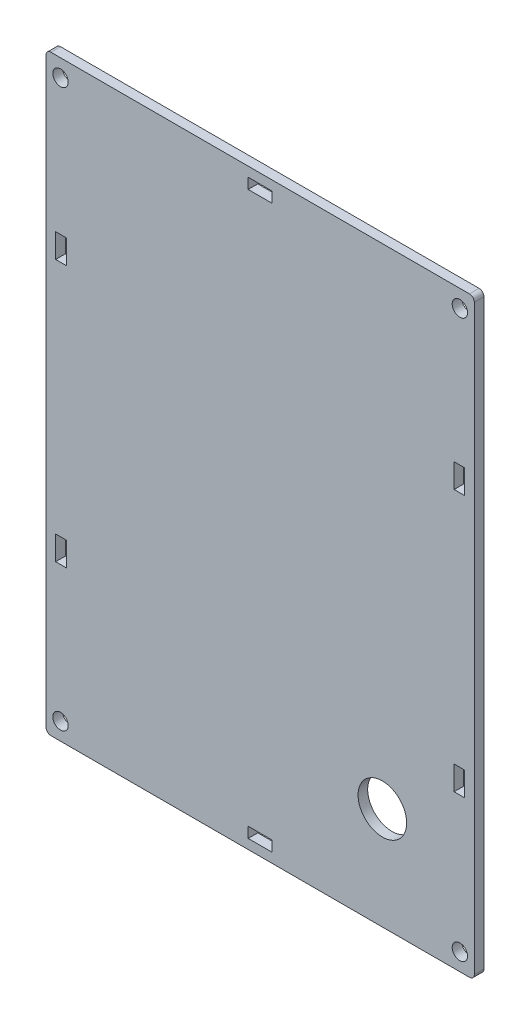
from build123d import *

# Parameters (mm, degrees)
SKETCH1_W           = 89
SKETCH1_H           = 123
SKETCH1_R           = 1.6
SKETCH1_W_2         = 5
SKETCH1_H_2         = 2.2
SKETCH1_W_3         = 2.2
SKETCH1_H_3         = 5
BOSS_EXTRUDE1_DEPTH = 1
FILLET1_R           = 1
CUT_EXTRUDE1_REACH  = 77.937
SKETCH2_R           = 5.05


with BuildPart() as part:
    # Sketch1 → Boss-Extrude1 (new, symmetric)
    with BuildSketch(Plane.XY):
        Rectangle(SKETCH1_W, SKETCH1_H)
        with Locations((-41.5, 57.9)):
            Circle(SKETCH1_R, mode=Mode.SUBTRACT)
        with Locations((-41.5, -57.9)):
            Circle(SKETCH1_R, mode=Mode.SUBTRACT)
        with Locations((41.5, -57.9)):
            Circle(SKETCH1_R, mode=Mode.SUBTRACT)
        with Locations((41.5, 57.9)):
            Circle(SKETCH1_R, mode=Mode.SUBTRACT)
        with Locations((0, -58.4)):
            Rectangle(SKETCH1_W_2, SKETCH1_H_2, mode=Mode.SUBTRACT)
        with Locations((0, 58.4)):
            Rectangle(SKETCH1_W_2, SKETCH1_H_2, mode=Mode.SUBTRACT)
        with Locations((-41.4, -27.2)):
            Rectangle(SKETCH1_W_3, SKETCH1_H_3, mode=Mode.SUBTRACT)
        with Locations((-41.4, 27.2)):
            Rectangle(SKETCH1_W_3, SKETCH1_H_3, mode=Mode.SUBTRACT)
        with Locations((41.4, -27.2)):
            Rectangle(SKETCH1_W_3, SKETCH1_H_3, mode=Mode.SUBTRACT)
        with Locations((41.4, 27.2)):
            Rectangle(SKETCH1_W_3, SKETCH1_H_3, mode=Mode.SUBTRACT)
    extrude(amount=BOSS_EXTRUDE1_DEPTH, both=True)

    # Fillet1
    fillet1_edges = [part.edges().sort_by_distance(p)[0] for p in [
        (44.5, 61.5, 0),
        (44.5, -61.5, 0),
        (-44.5, -61.5, 0),
        (-44.5, 61.5, 0),
    ]]
    fillet(fillet1_edges, radius=FILLET1_R)

    # Sketch2 → Cut-Extrude1 (cut, up to next)
    with BuildSketch(Plane.XY.offset(1), mode=Mode.PRIVATE) as cut_extrude1_sk1:
        with Locations((25.390121282, -40.253691335)):
            Circle(SKETCH2_R)
    cut_extrude1_tool1 = extrude(cut_extrude1_sk1.sketch, amount=-CUT_EXTRUDE1_REACH, mode=Mode.PRIVATE) & part.part
    add(cut_extrude1_tool1.solids().sort_by_distance((25.390121, -40.253691, 1))[0], mode=Mode.SUBTRACT)


solid = part.part
